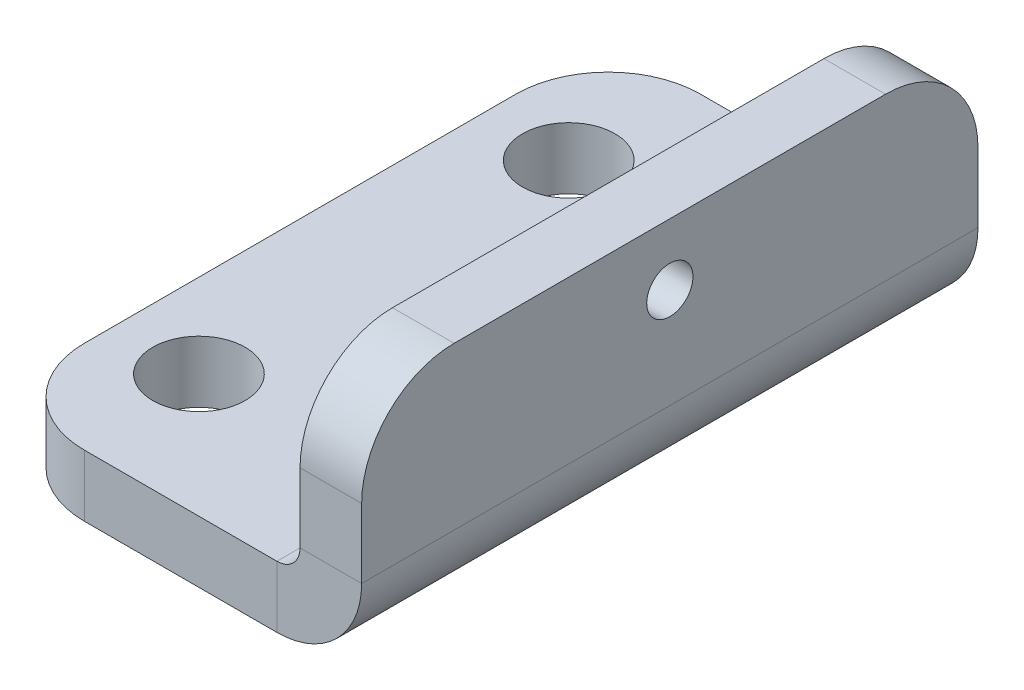
from build123d import *

# Parameters (mm, degrees)
SKETCH1_R                    = 1.5
BASE_FLANGE1_DEPTH           = 2
EDGE_FLANGE1_STRIP_W         = 9.5
EDGE_FLANGE1_STRIP_H         = 2
EDGE_FLANGE1_STRIP_CUT_DEPTH = 20
EDGE_FLANGE1_DEPTH           = 20
SKETCH9_R                    = 0.75
CUT_EXTRUDE1_DEPTH           = 10
FILLET1_R                    = 3
SCALE1_SCALE                 = 1.8


# Sheet-metal steps are written as plain solids
with BuildPart() as part:
    # Sketch1 → Base-Flange1 (new body)
    with BuildSketch(Plane(origin=(0, 0, 0), x_dir=(1, 0, 0), z_dir=(0, 1, 0))):
        with BuildLine():
            Line((0, 7), (0, -7))
            ThreePointArc((0, -7), (0.878679656, -9.121320344), (3, -10))
            Line((3, -10), (12, -10))
            Line((12, -10), (12, 10))
            Line((12, 10), (3, 10))
            ThreePointArc((3, 10), (0.878679656, 9.121320344), (0, 7))
        make_face()
        with Locations(Location((2.72, 6, 0), (0, 0, 270))):
            Circle(SKETCH1_R, mode=Mode.SUBTRACT)
        with Locations(Location((2.72, -6, 0), (0, 0, 270))):
            Circle(SKETCH1_R, mode=Mode.SUBTRACT)
    extrude(amount=BASE_FLANGE1_DEPTH)

    # Edge-Flange1 strip (across the edge) → Edge-Flange1 strip cut (cut)
    with BuildSketch(Plane(origin=(12, 2, 10), x_dir=(-1, 0, 0), z_dir=(0, 0, -1))):
        with Locations((-2, -1)):
            Rectangle(EDGE_FLANGE1_STRIP_W, EDGE_FLANGE1_STRIP_H)
    extrude(amount=EDGE_FLANGE1_STRIP_CUT_DEPTH, mode=Mode.SUBTRACT)

    # Edge-Flange1 section (across the edge) → Edge-Flange1 (add)
    with BuildSketch(Plane(origin=(12, 2, 10), x_dir=(-1, 0, 0), z_dir=(0, 0, -1))):
        with BuildLine():
            Line((0, 0.75), (0, 6))
            Line((0, 6), (2, 6))
            Line((2, 6), (2, 0.75))
            ThreePointArc((2, 0.75), (2.219669914, 0.219669914), (2.75, 0))
            Line((2.75, 0), (2.75, -2))
            ThreePointArc((2.75, -2), (0.805456352, -1.194543648), (0, 0.75))
        make_face()
    extrude(amount=EDGE_FLANGE1_DEPTH)

    # Sketch9 → Cut-Extrude1 (cut)
    with BuildSketch(Plane.ZY.offset(-10)):
        with Locations(Location((0, 6, 0), (0, 0, 270))):
            Circle(SKETCH9_R)
    extrude(amount=-CUT_EXTRUDE1_DEPTH, mode=Mode.SUBTRACT)

    # Fillet1
    fillet1_edges = [part.edges().sort_by_distance(p)[0] for p in [
        (11, 8, 10),
        (11, 8, -10),
    ]]
    fillet(fillet1_edges, radius=FILLET1_R)


with BuildPart() as part_1:
    # Scale1: scaled about (7.730300008, 2.413989503, 0)
    add(part.part.scale(SCALE1_SCALE).moved(Location((-6.184240006, -1.931191602, 0))))


solid = part_1.part
